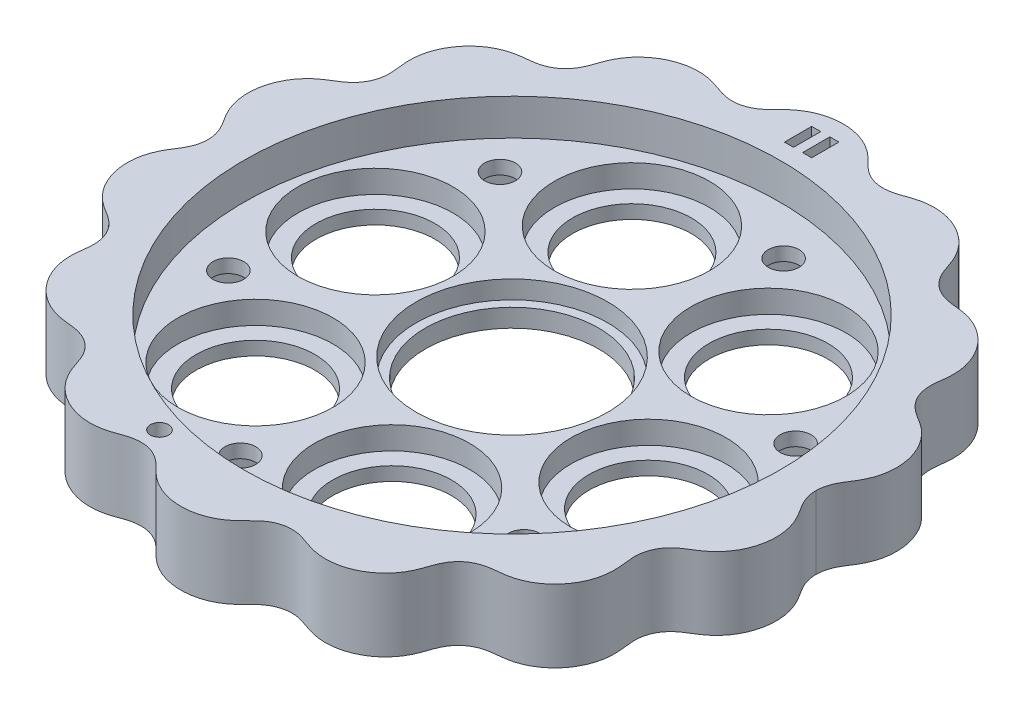
from build123d import *

# Parameters (mm, degrees)
BOSS_EXTRUDE1_START     = -4
BOSS_EXTRUDE1_DEPTH     = 8
CUT_EXTRUDE1_DEPTH      = 52.250027062
CUT_EXTRUDE1_DEPTH_BACK = 52.250027062
SKETCH2_R               = 9.55
SKETCH2_R_2             = 6.55
SKETCH2_3_R             = 8.55
SKETCH2_3_R_2           = 6.55
CUT_EXTRUDE2_DEPTH      = 2.5
SKETCH2_4_R             = 10.55
CUT_EXTRUDE3_DEPTH      = 2
SKETCH3_R               = 29.55
CUT_EXTRUDE4_DEPTH      = 4
M3_CLEARANCE_HOLE1_D    = 3.4
CIRPATTERN1_COUNT       = 6
SKETCH6_W               = 1
SKETCH6_H               = 3
CUT_EXTRUDE5_DEPTH      = 1
SKETCH7_R               = 1
CUT_EXTRUDE6_DEPTH      = 52.716199344
CUT_EXTRUDE7_DEPTH      = 2.5
CIRPATTERN2_COUNT       = 6


# Read off the part's stored shape, not the designer's step: Boss-Extrude1
with BuildPart() as part:
    # Boss-Extrude1 outline → Boss-Extrude1 (new body)
    with BuildSketch(Plane(origin=(0, 0, 0), x_dir=(1, 0, 0), z_dir=(0, 1, 0)).offset(BOSS_EXTRUDE1_START)):
        with BuildLine():
            add(Edge.make_bspline(
                [(-33.5, 0), (-33.5, -0.026216999), (-33.500676508, -0.078516883), (-33.503720786, -0.17775582), (-33.511828234, -0.31173155), (-33.526996005, -0.466553375), (-33.553178346, -0.648175674), (-33.595200404, -0.863501485), (-33.658349532, -1.10314746), (-33.755415178, -1.398683736), (-33.889559441, -1.721239842), (-34.066731542, -2.066386483), (-34.33759803, -2.518215594), (-34.671013568, -3.021062626), (-35.03546231, -3.624607433), (-35.370726301, -4.368821862), (-35.609453109, -5.158864299), (-35.744483574, -5.982665392), (-35.772828645, -6.825919268), (-35.693211073, -7.682386348), (-35.501360808, -8.537562558), (-35.193670934, -9.376126546), (-34.767373181, -10.179330804), (-34.246086609, -10.899309491), (-33.644509503, -11.523703616), (-32.981369347, -12.049691614), (-32.281005781, -12.481820472), (-31.557913996, -12.917579235), (-30.885601984, -13.470265954), (-30.320237066, -14.182401451), (-29.929060625, -15.044641799), (-29.765973817, -15.951454589), (-29.796625986, -16.842307921), (-29.919496462, -17.680578946), (-29.994109421, -18.486445579), (-29.970422891, -19.305733752), (-29.839019378, -20.123968135), (-29.598815637, -20.926920201), (-29.253507595, -21.70038835), (-28.811791246, -22.426327046), (-28.280949512, -23.093165852), (-27.668357299, -23.689854991), (-26.98234232, -24.204818907), (-26.246671177, -24.619277383), (-25.475694739, -24.927912635), (-24.684397307, -25.130544122), (-23.889238144, -25.23534295), (-23.053536492, -25.301869109), (-22.188604824, -25.467257846), (-21.344546827, -25.821771625), (-20.587650513, -26.389901962), (-20.016055801, -27.096102653), (-19.624872317, -27.871682111), (-19.361069448, -28.664169016), (-19.103509741, -29.428296904), (-18.7488428, -30.186670563), (-18.282031876, -30.915554812), (-17.698350342, -31.593948744), (-17.004041398, -32.201958542), (-16.2465509, -32.699186502), (-15.445615889, -33.084098119), (-14.617728676, -33.356901965), (-13.778608303, -33.518611569), (-12.939030982, -33.568963908), (-12.114233015, -33.509464815), (-11.317395219, -33.346812438), (-10.559764654, -33.095665291), (-9.887911891, -32.836316973), (-9.267306948, -32.659338385), (-8.584975924, -32.552288483), (-7.83888586, -32.552738679), (-6.979015726, -32.743141837), (-6.126424119, -33.187594876), (-5.429263358, -33.777041859), (-4.842041993, -34.404312843), (-4.25769149, -34.968126103), (-3.597367299, -35.466045575), (-2.865482816, -35.879676417), (-2.071892425, -36.197183166), (-1.23030686, -36.410514225), (-0.360960634, -36.514017215), (0.52151503, -36.504155124), (1.402580135, -36.377943561), (2.265443111, -36.132659599), (3.066444844, -35.780474857), (3.791545139, -35.33364412), (4.43489918, -34.810217959), (4.998051196, -34.235523945), (5.573384318, -33.640780609), (6.249034288, -33.116879541), (6.949050876, -32.777050552), (7.624399022, -32.603954715), (8.337482123, -32.541890188), (9.029133767, -32.596976051), (9.773668183, -32.792127482), (10.559745239, -33.095706545), (11.317406375, -33.34678892), (12.114227112, -33.50947723), (12.9390348, -33.568955885), (13.778605865, -33.518616691), (14.617730145, -33.35689888), (15.445614995, -33.084099997), (16.246551449, -32.699185349), (17.004041059, -32.201959254), (17.698350553, -31.593948301), (18.282031748, -30.91555508), (18.748842876, -30.186670404), (19.103509697, -29.428296997), (19.361069473, -28.664168964), (19.624872304, -27.871682137), (20.016055808, -27.096102638), (20.587650509, -26.389901972), (21.344546829, -25.821771619), (22.188604822, -25.46725785), (23.053536493, -25.301869106), (23.889238143, -25.235342952), (24.684397307, -25.130544121), (25.475694738, -24.927912635), (26.246671177, -24.619277382), (26.98234232, -24.204818907), (27.668357299, -23.689854991), (28.280949512, -23.093165852), (28.811791246, -22.426327046), (29.253507595, -21.70038835), (29.598815637, -20.926920201), (29.839019378, -20.123968135), (29.970422891, -19.305733752), (29.994109421, -18.486445579), (29.919496462, -17.680578946), (29.796625986, -16.842307922), (29.765973818, -15.951454588), (29.929060625, -15.044641801), (30.320237067, -14.182401447), (30.885601984, -13.47026596), (31.557913996, -12.917579226), (32.281005781, -12.48182049), (32.981369347, -12.049691583), (33.644509502, -11.523703669), (34.246086611, -10.899309401), (34.767373178, -10.179330954), (35.193670939, -9.376126304), (35.501360801, -8.537562951), (35.693211085, -7.682385707), (35.772828626, -6.825920319), (35.744483605, -5.982663662), (35.60945306, -5.158866966), (35.370726381, -4.368817521), (35.035462148, -3.624616246), (34.671013847, -3.021047438), (34.337597591, -2.518239495), (34.0667323, -2.066345207), (33.889558103, -1.721312631), (33.755417335, -1.398566328), (33.668053086, -1.132864283), (33.618885538, -0.953154649), (33.58413629, -0.801665223), (33.560165158, -0.679428658), (33.540088712, -0.557083857), (33.523961811, -0.435703148), (33.511828137, -0.311736406), (33.503720817, -0.177726374), (33.500676512, -0.078536656), (33.5, -0.026216999), (33.5, 0)],
                knots=[0.077924489, 0.077924489, 0.077924489, 0.077924489, 0.077924489, 0.078793536, 0.079662583, 0.08053163, 0.081400677, 0.083138771, 0.084876866, 0.08661496, 0.088353054, 0.091829242, 0.094643636, 0.09745803, 0.103086817, 0.108715605, 0.114344392, 0.120231296, 0.126118199, 0.132005103, 0.137892006, 0.144234493, 0.150576979, 0.156919465, 0.163261951, 0.16901636, 0.174770769, 0.180525178, 0.186279587, 0.192629374, 0.198979161, 0.205738622, 0.212498084, 0.218150826, 0.223803567, 0.229456308, 0.235109049, 0.241018837, 0.246928625, 0.252838412, 0.2587482, 0.264732536, 0.270716873, 0.276701209, 0.282685545, 0.288287821, 0.293890097, 0.299492372, 0.305094648, 0.311756408, 0.318418167, 0.32486003, 0.331301892, 0.336941113, 0.342580334, 0.348219556, 0.353858777, 0.360295182, 0.366731587, 0.373167991, 0.379604396, 0.385566533, 0.39152867, 0.397490807, 0.403452943, 0.409029196, 0.414605448, 0.420181701, 0.425757954, 0.429186625, 0.432615297, 0.439472641, 0.446509144, 0.453545648, 0.459217649, 0.46488965, 0.47056165, 0.476233651, 0.482290415, 0.48834718, 0.494403944, 0.500460708, 0.506717837, 0.512974966, 0.519232095, 0.525489224, 0.531115727, 0.536742229, 0.542368732, 0.547995235, 0.554261307, 0.560527379, 0.56395605, 0.567384722, 0.574242066, 0.579818318, 0.585394571, 0.590970824, 0.596547076, 0.602509213, 0.60847135, 0.614433486, 0.620395623, 0.626832028, 0.633268433, 0.639704838, 0.646141243, 0.651780464, 0.657419685, 0.663058906, 0.668698127, 0.67513999, 0.681581852, 0.688243612, 0.694905371, 0.700507647, 0.706109923, 0.711712199, 0.717314474, 0.723298811, 0.729283147, 0.735267483, 0.741251819, 0.747161607, 0.753071395, 0.758981183, 0.76489097, 0.770543711, 0.776196453, 0.781849194, 0.787501935, 0.794261397, 0.801020859, 0.807370646, 0.813720433, 0.819474842, 0.82522925, 0.830983659, 0.836738068, 0.843080554, 0.849423041, 0.855765527, 0.862108013, 0.867994917, 0.87388182, 0.879768724, 0.885655627, 0.891284415, 0.896913202, 0.90254199, 0.905356383, 0.908170777, 0.911646965, 0.91338506, 0.915123154, 0.915992201, 0.916861248, 0.917730295, 0.918599342, 0.919468389, 0.920337437, 0.921206484, 0.922075531, 0.922075531, 0.922075531, 0.922075531, 0.922075531], degree=4))
            add(Edge.make_bspline(
                [(33.5, 0), (33.5, 0.026216999), (33.500676509, 0.078518569), (33.50372079, 0.177636225), (33.511828237, 0.311674182), (33.526995975, 0.46660924), (33.553178416, 0.648159698), (33.595200306, 0.863501283), (33.658349623, 1.10314951), (33.755415083, 1.398682138), (33.889559527, 1.721240899), (34.066731475, 2.066385879), (34.337598093, 2.518215923), (34.671013511, 3.021062435), (35.035462344, 3.624607543), (35.370726286, 4.368821806), (35.609453118, 5.158864334), (35.744483568, 5.982665369), (35.772828649, 6.825919283), (35.69321107, 7.682386338), (35.50136081, 8.537562565), (35.193670932, 9.376126539), (34.767373183, 10.179330812), (34.246086607, 10.899309483), (33.644509507, 11.523703626), (32.981369344, 12.049691606), (32.281005781, 12.481820466), (31.557913997, 12.917579248), (30.885601984, 13.470265945), (30.320237064, 14.182401458), (29.929060631, 15.044641793), (29.765973806, 15.951454597), (29.796626007, 16.84230791), (29.919496442, 17.680578957), (29.994109429, 18.486445574), (29.970422889, 19.305733754), (29.839019379, 20.123968134), (29.598815637, 20.926920201), (29.253507595, 21.70038835), (28.811791246, 22.426327046), (28.280949512, 23.093165852), (27.668357299, 23.689854991), (26.98234232, 24.204818907), (26.246671177, 24.619277384), (25.47569474, 24.927912633), (24.684397304, 25.130544131), (23.88923815, 25.235342928), (23.053536485, 25.301869131), (22.18860483, 25.467257833), (21.344546821, 25.821771631), (20.587650521, 26.389901958), (20.01605579, 27.096102656), (19.624872331, 27.87168211), (19.361069436, 28.664169017), (19.103509747, 29.428296904), (18.748842783, 30.186670563), (18.282031917, 30.915554813), (17.698350267, 31.593948741), (17.004041524, 32.201958546), (16.246550693, 32.699186495), (15.44561623, 33.084098131), (14.617728116, 33.356901945), (13.778609236, 33.518611602), (12.939029518, 33.568963857), (12.114235287, 33.509464894), (11.317390885, 33.346812298), (10.55977243, 33.095665511), (9.887900123, 32.836316749), (9.267320451, 32.6593381), (8.706237056, 32.57131778), (8.215146041, 32.552498079), (7.624379241, 32.603984554), (6.949064821, 32.77702953), (6.249024969, 33.116893571), (5.573390361, 33.640771534), (4.998047425, 34.23552959), (4.43490147, 34.810214547), (3.791543723, 35.333646174), (3.06644575, 35.78047365), (2.2654425, 36.132660246), (1.402580594, 36.37794332), (0.521514606, 36.504155024), (-0.360960137, 36.514017681), (-1.230307555, 36.410513277), (-2.071891361, 36.197184826), (-2.865484417, 35.879673792), (-3.59736483, 35.466049685), (-4.257696094, 34.968118398), (-4.842034252, 34.404325812), (-5.429275888, 33.777020825), (-6.126406081, 33.187625198), (-6.9790442, 32.743093944), (-7.959870147, 32.526018012), (-8.909996394, 32.565833875), (-9.773705477, 32.792081747), (-10.559723503, 33.095734538), (-11.317419057, 33.346772326), (-12.114220372, 33.50948609), (-12.939039168, 33.568950135), (-13.778603073, 33.518620368), (-14.617731827, 33.356896665), (-15.445613969, 33.084101347), (-16.246552081, 32.69918452), (-17.004040667, 32.201959765), (-17.6983508, 31.593947983), (-18.282031594, 30.915555272), (-18.748842974, 30.18667029), (-19.103509636, 29.428297062), (-19.361069498, 28.664168928), (-19.6248723, 27.871682154), (-20.016055808, 27.09610263), (-20.587650509, 26.389901974), (-21.344546828, 25.821771621), (-22.188604825, 25.46725784), (-23.053536488, 25.301869126), (-23.889238148, 25.235342931), (-24.684397305, 25.130544129), (-25.475694739, 24.927912633), (-26.246671177, 24.619277383), (-26.98234232, 24.204818907), (-27.668357299, 23.689854991), (-28.280949511, 23.093165852), (-28.811791246, 22.426327046), (-29.253507595, 21.70038835), (-29.598815637, 20.926920201), (-29.839019379, 20.123968134), (-29.970422889, 19.305733754), (-29.994109429, 18.486445574), (-29.919496442, 17.680578956), (-29.796626007, 16.842307911), (-29.765973806, 15.951454596), (-29.929060631, 15.044641795), (-30.320237064, 14.182401454), (-30.885601984, 13.47026595), (-31.557913997, 12.917579239), (-32.281005781, 12.481820484), (-32.981369344, 12.049691575), (-33.644509506, 11.523703679), (-34.246086608, 10.899309394), (-34.767373181, 10.179330959), (-35.193670937, 9.3761263), (-35.501360803, 8.537562954), (-35.693211082, 7.682385704), (-35.77282863, 6.825920322), (-35.744483599, 5.982663659), (-35.60945307, 5.158866969), (-35.370726364, 4.368817517), (-35.035462184, 3.624616252), (-34.671013786, 3.021047426), (-34.33759766, 2.518239543), (-34.066732221, 2.066345083), (-33.889558211, 1.721312861), (-33.755417207, 1.398566007), (-33.668053204, 1.132864324), (-33.618885449, 0.953157317), (-33.584136315, 0.801658282), (-33.560165169, 0.679422844), (-33.540088707, 0.557106056), (-33.523961806, 0.435734261), (-33.511828138, 0.311679462), (-33.503720818, 0.17760792), (-33.500676512, 0.078538627), (-33.5, 0.026216999), (-33.5, 0)],
                knots=[0.077924489, 0.077924489, 0.077924489, 0.077924489, 0.077924489, 0.078793536, 0.079662583, 0.08053163, 0.081400677, 0.083138771, 0.084876866, 0.08661496, 0.088353054, 0.091829242, 0.094643636, 0.09745803, 0.103086817, 0.108715605, 0.114344392, 0.120231296, 0.126118199, 0.132005103, 0.137892006, 0.144234493, 0.150576979, 0.156919465, 0.163261951, 0.16901636, 0.174770769, 0.180525178, 0.186279587, 0.192629374, 0.198979161, 0.205738622, 0.212498084, 0.218150826, 0.223803567, 0.229456308, 0.235109049, 0.241018837, 0.246928625, 0.252838412, 0.2587482, 0.264732536, 0.270716873, 0.276701209, 0.282685545, 0.288287821, 0.293890097, 0.299492372, 0.305094648, 0.311756408, 0.318418167, 0.32486003, 0.331301892, 0.336941113, 0.342580334, 0.348219556, 0.353858777, 0.360295182, 0.366731587, 0.373167991, 0.379604396, 0.385566533, 0.39152867, 0.397490807, 0.403452943, 0.409029196, 0.414605448, 0.420181701, 0.425757954, 0.429186625, 0.432615297, 0.436043969, 0.439472641, 0.445738713, 0.452004785, 0.457631287, 0.46325779, 0.468884293, 0.474510796, 0.480767924, 0.487025053, 0.493282182, 0.499539311, 0.505596076, 0.51165284, 0.517709604, 0.523766368, 0.529438369, 0.53511037, 0.540782371, 0.546454371, 0.553490875, 0.560527379, 0.567384722, 0.574242066, 0.579818318, 0.585394571, 0.590970824, 0.596547076, 0.602509213, 0.60847135, 0.614433486, 0.620395623, 0.626832028, 0.633268433, 0.639704838, 0.646141243, 0.651780464, 0.657419685, 0.663058906, 0.668698127, 0.67513999, 0.681581852, 0.688243612, 0.694905371, 0.700507647, 0.706109923, 0.711712199, 0.717314474, 0.723298811, 0.729283147, 0.735267483, 0.741251819, 0.747161607, 0.753071395, 0.758981183, 0.76489097, 0.770543711, 0.776196453, 0.781849194, 0.787501935, 0.794261397, 0.801020859, 0.807370646, 0.813720433, 0.819474842, 0.82522925, 0.830983659, 0.836738068, 0.843080554, 0.849423041, 0.855765527, 0.862108013, 0.867994917, 0.87388182, 0.879768724, 0.885655627, 0.891284415, 0.896913202, 0.90254199, 0.905356383, 0.908170777, 0.911646965, 0.91338506, 0.915123154, 0.915992201, 0.916861248, 0.917730295, 0.918599342, 0.919468389, 0.920337437, 0.921206484, 0.922075531, 0.922075531, 0.922075531, 0.922075531, 0.922075531], degree=4))
        make_face()
    extrude(amount=BOSS_EXTRUDE1_DEPTH)

    # Sketch2 → Cut-Extrude1 (cut, two sides: drawn at the far end of the back side and taken through both)
    with BuildSketch(Plane(origin=(0, 0, 0), x_dir=(1, 0, 0), z_dir=(0, 1, 0)).offset(-CUT_EXTRUDE1_DEPTH_BACK)):
        with Locations(Location((0, 0, 0), (0, 0, 270))):
            Circle(SKETCH2_R)
        with Locations(Location((-19.498558244, 4.450418679, 0), (0, 0, 270))):
            Circle(SKETCH2_R_2)
        with Locations(Location((-5.895103488, 19.111456116, 0), (0, 0, 270))):
            Circle(SKETCH2_R_2)
        with Locations(Location((13.603454755, 14.661037437, 0), (0, 0, 270))):
            Circle(SKETCH2_R_2)
        with Locations(Location((19.498558244, -4.450418679, 0), (0, 0, 270))):
            Circle(SKETCH2_R_2)
        with Locations(Location((5.895103488, -19.111456116, 0), (0, 0, 270))):
            Circle(SKETCH2_R_2)
        with Locations(Location((-13.603454755, -14.661037437, 0), (0, 0, 270))):
            Circle(SKETCH2_R_2)
    extrude(amount=CUT_EXTRUDE1_DEPTH + CUT_EXTRUDE1_DEPTH_BACK, mode=Mode.SUBTRACT)

    # Sketch2<3> → Cut-Extrude2 (cut, symmetric)
    # profile 1 of 6: a face of its own
    with BuildSketch(Plane(origin=(0, 0, 0), x_dir=(1, 0, 0), z_dir=(0, 1, 0))):
        with Locations(Location((-19.498558244, 4.450418679, 0), (0, 0, 270))):
            Circle(SKETCH2_3_R)
        with Locations(Location((-19.498558244, 4.450418679, 0), (0, 0, 270))):
            Circle(SKETCH2_3_R_2, mode=Mode.SUBTRACT)
    # profile 2 of 6: a face of its own
    with BuildSketch(Plane(origin=(0, 0, 0), x_dir=(1, 0, 0), z_dir=(0, 1, 0))):
        with Locations(Location((-5.895103488, 19.111456116, 0), (0, 0, 270))):
            Circle(SKETCH2_3_R)
        with Locations(Location((-5.895103488, 19.111456116, 0), (0, 0, 270))):
            Circle(SKETCH2_3_R_2, mode=Mode.SUBTRACT)
    # profile 3 of 6: a face of its own
    with BuildSketch(Plane(origin=(0, 0, 0), x_dir=(1, 0, 0), z_dir=(0, 1, 0))):
        with Locations(Location((13.603454755, 14.661037437, 0), (0, 0, 270))):
            Circle(SKETCH2_3_R)
        with Locations(Location((13.603454755, 14.661037437, 0), (0, 0, 270))):
            Circle(SKETCH2_3_R_2, mode=Mode.SUBTRACT)
    # profile 4 of 6: a face of its own
    with BuildSketch(Plane(origin=(0, 0, 0), x_dir=(1, 0, 0), z_dir=(0, 1, 0))):
        with Locations(Location((19.498558244, -4.450418679, 0), (0, 0, 270))):
            Circle(SKETCH2_3_R)
        with Locations(Location((19.498558244, -4.450418679, 0), (0, 0, 270))):
            Circle(SKETCH2_3_R_2, mode=Mode.SUBTRACT)
    # profile 5 of 6: a face of its own
    with BuildSketch(Plane(origin=(0, 0, 0), x_dir=(1, 0, 0), z_dir=(0, 1, 0))):
        with Locations(Location((5.895103488, -19.111456116, 0), (0, 0, 270))):
            Circle(SKETCH2_3_R)
        with Locations(Location((5.895103488, -19.111456116, 0), (0, 0, 270))):
            Circle(SKETCH2_3_R_2, mode=Mode.SUBTRACT)
    # profile 6 of 6: a face of its own
    with BuildSketch(Plane(origin=(0, 0, 0), x_dir=(1, 0, 0), z_dir=(0, 1, 0))):
        with Locations(Location((-13.603454755, -14.661037437, 0), (0, 0, 270))):
            Circle(SKETCH2_3_R)
        with Locations(Location((-13.603454755, -14.661037437, 0), (0, 0, 270))):
            Circle(SKETCH2_3_R_2, mode=Mode.SUBTRACT)
    extrude(amount=CUT_EXTRUDE2_DEPTH, both=True, mode=Mode.SUBTRACT)

    # Sketch2<4> → Cut-Extrude3 (cut, symmetric)
    with BuildSketch(Plane(origin=(0, 0, 0), x_dir=(1, 0, 0), z_dir=(0, 1, 0))):
        with Locations(Location((0, 0, 0), (0, 0, 270))):
            Circle(SKETCH2_4_R)
    extrude(amount=CUT_EXTRUDE3_DEPTH, both=True, mode=Mode.SUBTRACT)

    # Sketch3 → Cut-Extrude4 (cut)
    with BuildSketch(Plane(origin=(0, 4, 0), x_dir=(1, 0, 0), z_dir=(0, 1, 0))):
        with Locations(Location((0, 0, 0), (0, 0, 270))):
            Circle(SKETCH3_R)
    extrude(amount=-CUT_EXTRUDE4_DEPTH, mode=Mode.SUBTRACT)

    # M3 Clearance Hole1 (through all)
    with Locations(Plane(origin=(0, 0, 0), x_dir=(1, 0, 0), z_dir=(0, 1, 0))):
        with Locations((23.889320145, 7.36887936)):
            m3_clearance_hole1 = Hole(M3_CLEARANCE_HOLE1_D / 2)

    # CirPattern1: M3 Clearance Hole1 ×6 about axis
    cirpattern1_axis = Axis((0, 0, 0), (0, 1, 0))
    for i in range(1, CIRPATTERN1_COUNT):
        add(m3_clearance_hole1.rotate(cirpattern1_axis, i * 360 / CIRPATTERN1_COUNT), mode=Mode.SUBTRACT)

    # Sketch6 → Cut-Extrude5 (cut)
    with BuildSketch(Plane(origin=(0, 4, 0), x_dir=(1, 0, 0), z_dir=(0, 1, 0))):
        with Locations((1, 33.024998189)):
            Rectangle(SKETCH6_W, SKETCH6_H)
        with Locations((-1, 33.024998189)):
            Rectangle(SKETCH6_W, SKETCH6_H)
    extrude(amount=-CUT_EXTRUDE5_DEPTH, mode=Mode.SUBTRACT)

    # Sketch7 → Cut-Extrude6 (cut, through all)
    with BuildSketch(Plane(origin=(0, 4, 0), x_dir=(1, 0, 0), z_dir=(0, 1, 0))):
        with Locations(Location((-8.471801288, -30.376447833, 0), (0, 0, 270))):
            Circle(SKETCH7_R)
    extrude(amount=-CUT_EXTRUDE6_DEPTH, mode=Mode.SUBTRACT)

    # Sketch8 → Cut-Extrude7 (cut)
    with BuildSketch(Plane.XZ.offset(4)):
        Polygon((-24.825293531, 4.334528169), (-21.729481622, 5.041127035), (-20.793508236, 8.075478226), (-22.953346759, 10.403230552), (-26.049158668, 9.696631686), (-26.985132054, 6.662280494), align=None)
    cut_extrude7 = extrude(amount=-CUT_EXTRUDE7_DEPTH, mode=Mode.SUBTRACT)

    # CirPattern2: Cut-Extrude7 ×6 about axis
    cirpattern2_axis = Axis((0, 0, 0), (0, 1, 0))
    for i in range(1, CIRPATTERN2_COUNT):
        add(cut_extrude7.rotate(cirpattern2_axis, i * 360 / CIRPATTERN2_COUNT), mode=Mode.SUBTRACT)


solid = part.part
